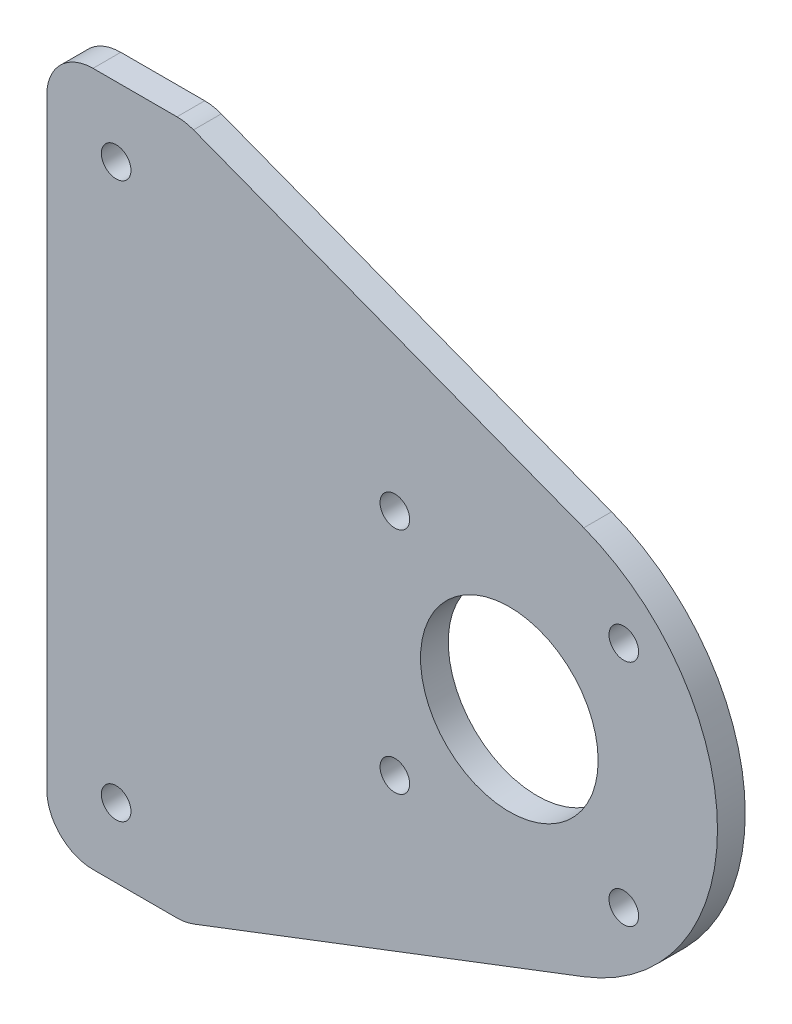
from build123d import *

# Parameters (mm, degrees)
SKETCH_2_R      = 9.6
SKETCH_2_R_2    = 1.6
EXTRUDE_1_DEPTH = 3
FILLET_3_R      = 5


with BuildPart() as part:
    # ｽｹｯﾁ2 → ﾎﾞｽ - 押し出し1 (new body)
    with BuildSketch(Plane.XY):
        with BuildLine():
            Line((-50, 37.5), (-50, -37.5))
            Line((-50, -37.5), (-35, -37.5))
            Line((-35, -37.5), (8.047963203, -21.011432323))
            ThreePointArc((8.047963203, -21.011432323), (22.5, 0), (8.047963203, 21.011432323))
            Line((8.047963203, 21.011432323), (-35, 37.5))
            Line((-35, 37.5), (-50, 37.5))
        make_face()
        Circle(SKETCH_2_R, mode=Mode.SUBTRACT)
        with Locations((-12.374368671, 12.374368671)):
            Circle(SKETCH_2_R_2, mode=Mode.SUBTRACT)
        with Locations((12.374368671, 12.374368671)):
            Circle(SKETCH_2_R_2, mode=Mode.SUBTRACT)
        with Locations((12.374368671, -12.374368671)):
            Circle(SKETCH_2_R_2, mode=Mode.SUBTRACT)
        with Locations((-12.374368671, -12.374368671)):
            Circle(SKETCH_2_R_2, mode=Mode.SUBTRACT)
        with Locations((-42.5, 30)):
            Circle(SKETCH_2_R_2, mode=Mode.SUBTRACT)
        with Locations((-42.5, -30)):
            Circle(SKETCH_2_R_2, mode=Mode.SUBTRACT)
    extrude(amount=EXTRUDE_1_DEPTH)

    # ﾌｨﾚｯﾄ3
    fillet_3_edges = [part.edges().sort_by_distance(p)[0] for p in [
        (-35, 37.5, 1.5),
        (-35, -37.5, 1.5),
        (-50, -37.5, 1.5),
        (-50, 37.5, 1.5),
    ]]
    fillet(fillet_3_edges, radius=FILLET_3_R)


solid = part.part
